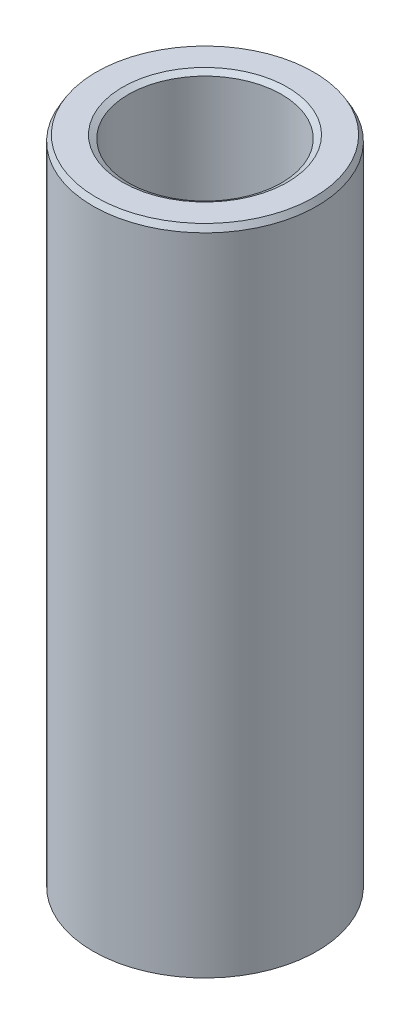
from build123d import *
from OCP.BRepFilletAPI import BRepFilletAPI_MakeChamfer

# Parameters (mm, degrees)
SKETCH1_R           = 27.5
BOSS_EXTRUDE1_DEPTH = 160.655673122
SKETCH2_R           = 18.803215903
CUT_EXTRUDE1_DEPTH  = 166.295932516
CHAMFER1_SIZE       = 1.430577928
CHAMFER1_SIZE2      = 0.825944552


with BuildPart() as part:
    # Sketch1 → Boss-Extrude1 (new body)
    with BuildSketch(Plane(origin=(0, 0, 0), x_dir=(1, 0, 0), z_dir=(0, 1, 0))):
        Circle(SKETCH1_R)
    extrude(amount=BOSS_EXTRUDE1_DEPTH)

    # Sketch2 → Cut-Extrude1 (cut, through all)
    with BuildSketch(Plane(origin=(0, 0, 0), x_dir=(1, 0, 0), z_dir=(0, 1, 0))):
        Circle(SKETCH2_R)
    extrude(amount=CUT_EXTRUDE1_DEPTH, mode=Mode.SUBTRACT)

    # Chamfer1: one chamfer whose edges measure the first distance from different faces: ONE call of the kernel's chamfer builder (chamfer() names one face for all edges)
    chamfer1_edges_1 = [part.edges().sort_by_distance(p)[0] for p in [
        (-18.803215903, 160.655673122, 0),
    ]]
    chamfer1_side_1 = [part.faces().sort_by_distance(p)[0] for p in [
        (-26.722182541, 160.655673122, 0),
    ]]
    chamfer1_edges_2 = [part.edges().sort_by_distance(p)[0] for p in [
        (-18.803215903, 0, 0),
    ]]
    chamfer1_side_2 = [part.faces().sort_by_distance(p)[0] for p in [
        (-18.803215903, 80.327836561, 0),
    ]]
    chamfer1_edges_3 = [part.edges().sort_by_distance(p)[0] for p in [
        (-27.5, 0, 0),
    ]]
    chamfer1_side_3 = [part.faces().sort_by_distance(p)[0] for p in [
        (-26.722182541, 0, 0),
    ]]
    chamfer1_edges_4 = [part.edges().sort_by_distance(p)[0] for p in [
        (-27.5, 160.655673122, 0),
    ]]
    chamfer1_side_4 = [part.faces().sort_by_distance(p)[0] for p in [
        (-27.5, 80.327836561, 0),
    ]]
    chamfer1 = BRepFilletAPI_MakeChamfer(part.part.solid().wrapped)
    for e in chamfer1_edges_1:
        chamfer1.Add(CHAMFER1_SIZE, CHAMFER1_SIZE2, e.wrapped, chamfer1_side_1[0].wrapped)  # the first distance lies on this face
    for e in chamfer1_edges_2:
        chamfer1.Add(CHAMFER1_SIZE, CHAMFER1_SIZE2, e.wrapped, chamfer1_side_2[0].wrapped)  # the first distance lies on this face
    for e in chamfer1_edges_3:
        chamfer1.Add(CHAMFER1_SIZE, CHAMFER1_SIZE2, e.wrapped, chamfer1_side_3[0].wrapped)  # the first distance lies on this face
    for e in chamfer1_edges_4:
        chamfer1.Add(CHAMFER1_SIZE, CHAMFER1_SIZE2, e.wrapped, chamfer1_side_4[0].wrapped)  # the first distance lies on this face
    add(Compound.cast(chamfer1.Shape()), mode=Mode.REPLACE)


solid = part.part
